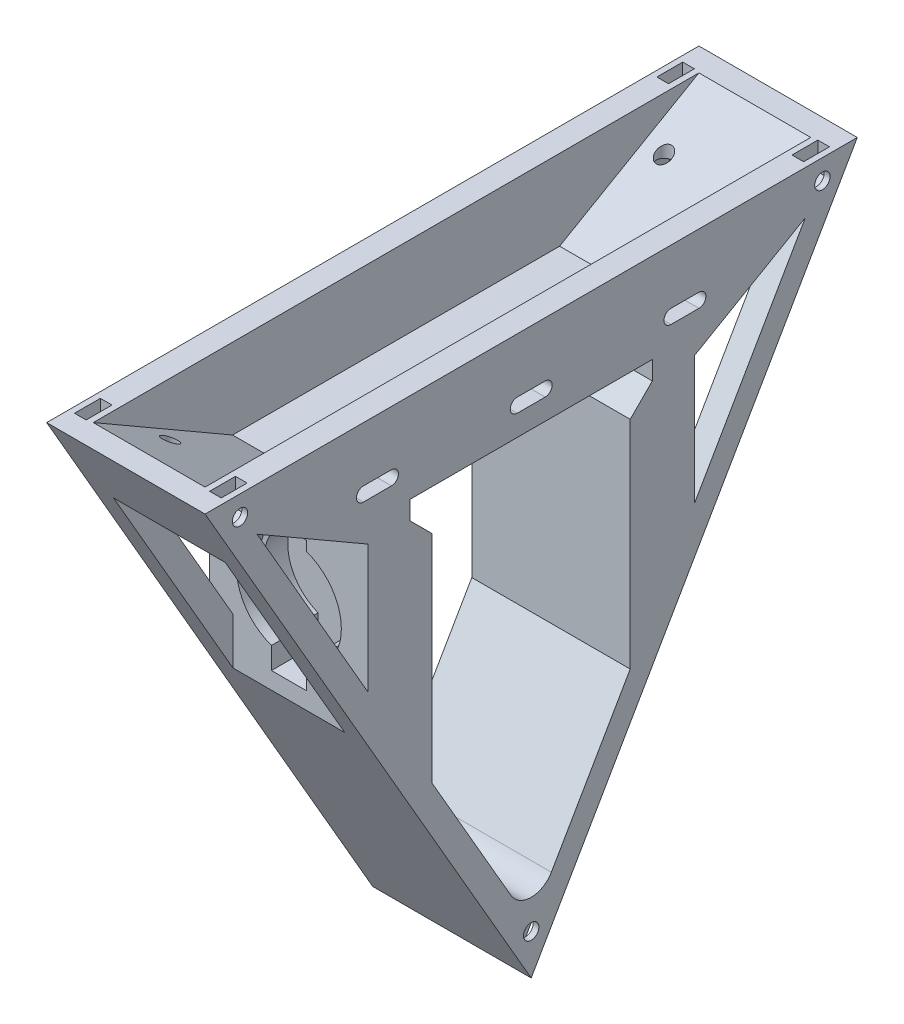
from build123d import *

# Parameters (mm, degrees)
SKETCH1_W                = 34
SKETCH1_H                = 2
BOSS_EXTRUDE1_DEPTH      = 50
BOSS_EXTRUDE2_DEPTH      = 17
BOSS_EXTRUDE2_DEPTH_BACK = 17
BOSS_EXTRUDE3_DEPTH      = 34
CUT_EXTRUDE2_DEPTH       = 34
SKETCH6_W                = 24
SKETCH6_H                = 100
CUT_EXTRUDE3_DEPTH       = 5
CUT_EXTRUDE4_REACH       = 143.028
SKETCH7_W                = 24
SKETCH7_H                = 18
BOSS_EXTRUDE4_DEPTH      = 34
SKETCH9_W                = 24
SKETCH9_H                = 57.679491924
CUT_EXTRUDE5_DEPTH       = 5
SKETCH11_R               = 13.25
SKETCH11_R_2             = 11.25
BOSS_EXTRUDE5_DEPTH      = 10
SKETCH12_R               = 11.25
SKETCH12_R_2             = 10.25
BOSS_EXTRUDE6_DEPTH      = 5
CUT_EXTRUDE7_START       = -10
CUT_EXTRUDE7_DEPTH       = 10
CIRPATTERN1_COUNT        = 2
SKETCH14_W               = 34
SKETCH14_H               = 40.677767497
BOSS_EXTRUDE7_DEPTH      = 10
MIRROR5_START            = -35
MIRROR5_DEPTH            = 10
MIRROR5_START_2          = -30
MIRROR5_2_DEPTH          = 5
BOSS_EXTRUDE14_DEPTH     = 5
CUT_EXTRUDE8_DEPTH       = 5.5
SKETCH24_R               = 1.625
CUT_EXTRUDE9_DEPTH       = 142.028365941
CUT_EXTRUDE10_DEPTH      = 10.5
FILLET3_R                = 5
SKETCH26_R               = 1.65
CUT_EXTRUDE11_DEPTH      = 4
CHAMFER1_SIZE            = 4.75
CUT_EXTRUDE17_DEPTH      = 130.076265064
CUT_EXTRUDE17_DEPTH_BACK = 130.076265064
SKETCH40_W               = 7.5
SKETCH40_H               = 2.568336691
CUT_EXTRUDE18_DEPTH      = 10
BOSS_EXTRUDE21_DEPTH     = 34
CUT_EXTRUDE19_DEPTH      = 118.053621039
SKETCH45_R               = 1.65
CUT_EXTRUDE20_DEPTH      = 0.6
CUT_EXTRUDE21_START      = -1.25
CUT_EXTRUDE21_DEPTH      = 2.5
CIRPATTERN3_COUNT        = 2
CIRPATTERN3_ANGLE        = 120
MIRROR14_START           = -1.25
MIRROR14_COPY_1_DEPTH    = 2.5
MIRROR14_COPY_2_DEPTH    = 2.5


# Read off the part's stored shape, not the designer's step: Mirror5
with BuildPart() as part:
    # Sketch1 → Boss-Extrude1 (new, symmetric)
    with BuildSketch(Plane.XY):
        Rectangle(SKETCH1_W, SKETCH1_H)
    extrude(amount=BOSS_EXTRUDE1_DEPTH, both=True)



with BuildPart() as body_2:
    # Sketch3 → Boss-Extrude2 (new, two sides: drawn at the far end of the back side and taken through both)
    with BuildSketch(Plane(origin=(0, 0, 0), x_dir=(0, 0, -1), z_dir=(1, 0, 0)).offset(-BOSS_EXTRUDE2_DEPTH_BACK)):
        Polygon((-70, 18.264518843), (0, -102.979037687), (70, 18.264518843), align=None)
        Polygon((61.339745962, 13.264518843), (-61.339745962, 13.264518843), (0, -92.979037687), align=None, mode=Mode.SUBTRACT)
    extrude(amount=BOSS_EXTRUDE2_DEPTH + BOSS_EXTRUDE2_DEPTH_BACK)


with BuildPart() as part_1:
    add(part.part)

    add(body_2.part)  # Boss-Extrude3 merges body 2
    # Sketch4 → Boss-Extrude3 (add)
    with BuildSketch(Plane(origin=(17, 0, 0), x_dir=(0, 0, -1), z_dir=(1, 0, 0))):
        Polygon((-58.839745962, 8.934391824), (-45.096976195, 1), (-35.096976195, 1), (-56.339745962, 13.264518843), (-61.339745962, 13.264518843), align=None)
    boss_extrude3 = extrude(amount=-BOSS_EXTRUDE3_DEPTH)

    # Sketch5 → Cut-Extrude2 (cut)
    with BuildSketch(Plane(origin=(17, 0, 0), x_dir=(0, 0, -1), z_dir=(1, 0, 0))):
        Polygon((-45.096976195, 1), (-41.63287458, -1), (-50, -1), (-50, 1), align=None)
    cut_extrude2 = extrude(amount=-CUT_EXTRUDE2_DEPTH, mode=Mode.SUBTRACT)

    # Sketch6 → Cut-Extrude3 (cut)
    with BuildSketch(Plane(origin=(0, 18.264518843, 0), x_dir=(1, 0, 0), z_dir=(0, 1, 0))):
        Rectangle(SKETCH6_W, SKETCH6_H)
    cut_extrude3 = extrude(amount=-CUT_EXTRUDE3_DEPTH, mode=Mode.SUBTRACT)

    # Cut-Extrude4: up to this face of the body (flat: up to its plane)
    cut_extrude4_end = Plane(part_1.part.faces().sort_by_distance((0, 7.132259422, 45.718361079))[0])
    # Sketch7 → Cut-Extrude4 (cut, up to the picked face)
    with BuildSketch(Plane(origin=(0, 18.264518843, 0), x_dir=(1, 0, 0), z_dir=(0, 1, 0)), mode=Mode.PRIVATE) as cut_extrude4_sk1:
        with Locations((0, -59)):
            Rectangle(SKETCH7_W, SKETCH7_H)
    cut_extrude4_tool1 = split(extrude(cut_extrude4_sk1.sketch, amount=-CUT_EXTRUDE4_REACH, mode=Mode.PRIVATE), bisect_by=cut_extrude4_end, keep=Keep.BOTH, mode=Mode.PRIVATE)
    cut_extrude4 = cut_extrude4_tool1.solids().sort_by(Axis((0, 18.264519, 59), (0, -1, 0)))[0]
    add(cut_extrude4, mode=Mode.SUBTRACT)

    # Mirror1: Boss-Extrude3, Cut-Extrude2, Cut-Extrude3, Cut-Extrude4 across plane
    add(boss_extrude3.mirror(Plane.XY))
    add(cut_extrude2.mirror(Plane.XY), mode=Mode.SUBTRACT)
    add(cut_extrude3.mirror(Plane.XY), mode=Mode.SUBTRACT)
    add(cut_extrude4.mirror(Plane.XY), mode=Mode.SUBTRACT)

    # Sketch8 → Boss-Extrude4 (add)
    with BuildSketch(Plane(origin=(17, 0, 0), x_dir=(0, 0, -1), z_dir=(1, 0, 0))):
        Polygon((-30, -1), (-30, -9), (-25, -9), (-25, -49.677767497), (-21.25, -56.172958026), (-21.25, -5), (-26, -5), (-26, -1), align=None)
    boss_extrude4 = extrude(amount=-BOSS_EXTRUDE4_DEPTH)

    # Sketch9 → Cut-Extrude5 (cut)
    with BuildSketch(Plane(origin=(0, -25.744759422, 44.591231347), x_dir=(1, 0, 0), z_dir=(0, -0.5000000000000003, 0.8660254037844385))):
        with Locations((0, 3.317537306)):
            Rectangle(SKETCH9_W, SKETCH9_H)
    cut_extrude5 = extrude(amount=-CUT_EXTRUDE5_DEPTH, mode=Mode.SUBTRACT)

    # Mirror2: Boss-Extrude4, Cut-Extrude5 across plane
    add(boss_extrude4.mirror(Plane.XY))
    add(cut_extrude5.mirror(Plane.XY), mode=Mode.SUBTRACT)

    # Sketch11 → Boss-Extrude5 (add)
    with BuildSketch(Plane.XY.offset(25)):
        with Locations((0, -23.423820239)):
            Circle(SKETCH11_R)
        with Locations(Location((0, -23.423820239, 0), (0, 0, 270))):
            Circle(SKETCH11_R_2, mode=Mode.SUBTRACT)
    extrude(amount=BOSS_EXTRUDE5_DEPTH)

    # Sketch12 → Boss-Extrude6 (add)
    with BuildSketch(Plane.XY.offset(25)):
        with Locations((0, -23.423820239)):
            Circle(SKETCH12_R)
        with Locations(Location((0, -23.423820239, 0), (0, 0, 270))):
            Circle(SKETCH12_R_2, mode=Mode.SUBTRACT)
    extrude(amount=BOSS_EXTRUDE6_DEPTH)

    # Sketch13 → Cut-Extrude7 (cut)
    with BuildSketch(Plane.XY.offset(35).offset(CUT_EXTRUDE7_START)):
        with BuildLine():
            Line((-3.75, -13.884428225), (-3.75, -10.715555212))
            ThreePointArc((-3.75, -10.715555212), (0, -10.173820239), (3.75, -10.715555212))
            Line((3.75, -10.715555212), (3.75, -13.884428225))
            ThreePointArc((3.75, -13.884428225), (0, -13.173820239), (-3.75, -13.884428225))
        make_face()
    cut_extrude7 = extrude(amount=CUT_EXTRUDE7_DEPTH, mode=Mode.SUBTRACT)

    # CirPattern1: Cut-Extrude7 ×2 about axis
    cirpattern1_axis = Axis((0, -23.423820239, 35), (0, 0, -1))
    for i in range(1, CIRPATTERN1_COUNT):
        add(cut_extrude7.rotate(cirpattern1_axis, i * 360 / CIRPATTERN1_COUNT), mode=Mode.SUBTRACT)

    # Sketch14 → Boss-Extrude7 (add)
    with BuildSketch(Plane.XY.offset(25)):
        with Locations((0, -29.338883749)):
            Rectangle(SKETCH14_W, SKETCH14_H)
        with BuildLine():
            ThreePointArc((3.75, -10.715555212), (13.25, -23.423820239), (3.75, -36.132085266))
            Line((3.75, -36.132085266), (-3.75, -36.132085266))
            ThreePointArc((-3.75, -36.132085266), (-13.25, -23.423820239), (-3.75, -10.715555212))
            Line((-3.75, -10.715555212), (3.75, -10.715555212))
        make_face(mode=Mode.SUBTRACT)
    extrude(amount=BOSS_EXTRUDE7_DEPTH)

    # Mirror5 outline → Mirror5 (add)
    with BuildSketch(Plane.XY.offset(MIRROR5_START)):
        Polygon((-17, -9), (-17, -49.677767497), (17, -49.677767497), (17, -9), (12, -9), (-12, -9), align=None)
        with BuildLine():
            Line((3.75, -36.132085266), (-3.75, -36.132085266))
            Line((-3.75, -36.132085266), (-3.75, -34.030421957))
            ThreePointArc((-3.75, -34.030421957), (-11.25, -23.423820239), (-3.75, -12.817218521))
            Line((-3.75, -12.817218521), (-3.75, -10.715555212))
            Line((-3.75, -10.715555212), (3.75, -10.715555212))
            Line((3.75, -10.715555212), (3.75, -12.817218521))
            ThreePointArc((3.75, -12.817218521), (11.25, -23.423820239), (3.75, -34.030421957))
            Line((3.75, -34.030421957), (3.75, -36.132085266))
        make_face(mode=Mode.SUBTRACT)
    extrude(amount=MIRROR5_DEPTH)

    # Mirror5 2 outline → Mirror5 2 (add)
    with BuildSketch(Plane.XY.offset(MIRROR5_START_2)):
        with BuildLine():
            ThreePointArc((-3.75, -12.817218521), (-11.25, -23.423820239), (-3.75, -34.030421957))
            Line((-3.75, -34.030421957), (-3.75, -32.963212253))
            ThreePointArc((-3.75, -32.963212253), (-10.25, -23.423820239), (-3.75, -13.884428225))
            Line((-3.75, -13.884428225), (-3.75, -12.817218521))
        make_face()
        with BuildLine():
            Line((3.75, -32.963212253), (3.75, -34.030421957))
            ThreePointArc((3.75, -34.030421957), (11.25, -23.423820239), (3.75, -12.817218521))
            Line((3.75, -12.817218521), (3.75, -13.884428225))
            ThreePointArc((3.75, -13.884428225), (10.25, -23.423820239), (3.75, -32.963212253))
        make_face()
    extrude(amount=MIRROR5_2_DEPTH)

    # Sketch22 → Boss-Extrude14 (add)
    with BuildSketch(Plane(origin=(17, 0, 0), x_dir=(0, 0, -1), z_dir=(1, 0, 0))):
        Polygon((-35.096976195, 1), (-56.339745962, 13.264518843), (56.339745962, 13.264518843), (35.096976195, 1), align=None)
    boss_extrude14 = extrude(amount=-BOSS_EXTRUDE14_DEPTH)

    # Mirror6: Boss-Extrude14 across plane
    add(boss_extrude14.mirror(Plane(origin=(0, 0, 0), x_dir=(0, 0, 1), z_dir=(1, 0, 0))))

    # Sketch23 → Cut-Extrude8 (cut)
    with BuildSketch(Plane.ZY.offset(-17)):
        with BuildLine():
            Line((-36, 6.5), (-30, 6.5))
            ThreePointArc((-30, 6.5), (-28.5, 5), (-30, 3.5))
            Line((-30, 3.5), (-36, 3.5))
            ThreePointArc((-36, 3.5), (-37.5, 5), (-36, 6.5))
        make_face()
        with BuildLine():
            Line((30, 6.5), (36, 6.5))
            ThreePointArc((36, 6.5), (37.5, 5), (36, 3.5))
            Line((36, 3.5), (30, 3.5))
            ThreePointArc((30, 3.5), (28.5, 5), (30, 6.5))
        make_face()
        with BuildLine():
            Line((-3, 6.5), (3, 6.5))
            ThreePointArc((3, 6.5), (4.5, 5), (3, 3.5))
            Line((3, 3.5), (-3, 3.5))
            ThreePointArc((-3, 3.5), (-4.5, 5), (-3, 6.5))
        make_face()
    extrude(amount=CUT_EXTRUDE8_DEPTH, mode=Mode.SUBTRACT)

    # Sketch24 → Cut-Extrude9 (cut, symmetric)
    with BuildSketch(Plane(origin=(0, 18.264518843, 0), x_dir=(1, 0, 0), z_dir=(0, 1, 0))):
        with Locations(Location((-7.5, -53, 0), (0, 0, 270))):
            Circle(SKETCH24_R)
        with Locations(Location((7.5, -53, 0), (0, 0, 270))):
            Circle(SKETCH24_R)
    cut_extrude9 = extrude(amount=CUT_EXTRUDE9_DEPTH, both=True, mode=Mode.SUBTRACT)

    # Sketch25 → Cut-Extrude10 (cut)
    with BuildSketch(Plane.XZ.offset(1)):
        Polygon((-10.68, 53), (-9.09, 50.246039216), (-5.91, 50.246039216), (-4.32, 53), (-5.91, 55.753960784), (-9.09, 55.753960784), align=None)
        Polygon((4.32, 53), (5.91, 50.246039216), (9.09, 50.246039216), (10.68, 53), (9.09, 55.753960784), (5.91, 55.753960784), align=None)
    cut_extrude10 = extrude(amount=-CUT_EXTRUDE10_DEPTH, mode=Mode.SUBTRACT)

    # Mirror7: Cut-Extrude9, Cut-Extrude10 across plane
    add(cut_extrude9.mirror(Plane.XY), mode=Mode.SUBTRACT)
    add(cut_extrude10.mirror(Plane.XY), mode=Mode.SUBTRACT)

    # Fillet3
    fillet3_edges = [part_1.edges().sort_by_distance(p)[0] for p in [
        (0, -92.979037687, 0),
    ]]
    fillet(fillet3_edges, radius=FILLET3_R)

    # Sketch26 → Cut-Extrude11 (cut)
    with BuildSketch(Plane.ZY.offset(17)):
        with Locations((-62.5, 13.934391824)):
            Circle(SKETCH26_R)
        with Locations((62.5, 13.934391824)):
            Circle(SKETCH26_R)
        with Locations((0, -94.318783649)):
            Circle(SKETCH26_R)
    cut_extrude11 = extrude(amount=-CUT_EXTRUDE11_DEPTH, mode=Mode.SUBTRACT)

    # Chamfer1
    chamfer1_edges = [part_1.edges().sort_by_distance(p)[0] for p in [
        (0, -5, -21.25),
        (0, -5, 21.25),
    ]]
    chamfer(chamfer1_edges, length=CHAMFER1_SIZE - 0.0001)  # a hair under: the kernel refuses the full size

    # Sketch39 → Cut-Extrude17 (cut, two sides: drawn at the far end of the back side and taken through both)
    with BuildSketch(Plane.ZY.offset(17).offset(-CUT_EXTRUDE17_DEPTH_BACK)):
        Polygon((-30.773502692, -49.677767497), (-35, -42.357259422), (-35, -49.677767497), align=None)
        Polygon((30.773502692, -49.677767497), (35, -49.677767497), (35, -42.357259422), align=None)
    extrude(amount=CUT_EXTRUDE17_DEPTH + CUT_EXTRUDE17_DEPTH_BACK, mode=Mode.SUBTRACT)

    # Sketch40 → Cut-Extrude18 (cut)
    with BuildSketch(Plane.XY.offset(35)):
        with Locations((0, -37.416253612)):
            Rectangle(SKETCH40_W, SKETCH40_H)
    cut_extrude18 = extrude(amount=-CUT_EXTRUDE18_DEPTH, mode=Mode.SUBTRACT)

    # Sketch41 → Boss-Extrude21 (add, through all)
    with BuildSketch(Plane(origin=(17, 0, 0), x_dir=(0, 0, -1), z_dir=(1, 0, 0))):
        Polygon((-41.63287458, -1), (-35, -4.829491924), (-35, -9), (-30, -9), (-30, -1), align=None)
        Polygon((30, -1), (41.63287458, -1), (35, -4.829491924), (35, -9), (30, -9), align=None)
    extrude(amount=-BOSS_EXTRUDE21_DEPTH)

    # Sketch42 → Cut-Extrude19 (cut, through all)
    with BuildSketch(Plane.XZ.offset(10.715555212)):
        with BuildLine():
            Line((-2, 28.5), (2, 28.5))
            ThreePointArc((2, 28.5), (3, 27.5), (2, 26.5))
            Line((2, 26.5), (-2, 26.5))
            ThreePointArc((-2, 26.5), (-3, 27.5), (-2, 28.5))
        make_face()
    cut_extrude19 = extrude(amount=-CUT_EXTRUDE19_DEPTH, mode=Mode.SUBTRACT)

    # Mirror11: Cut-Extrude18, Cut-Extrude19 across plane
    add(cut_extrude18.mirror(Plane.XY), mode=Mode.SUBTRACT)
    add(cut_extrude19.mirror(Plane.XY), mode=Mode.SUBTRACT)

    # Sketch45 → Cut-Extrude20 (cut)
    with BuildSketch(Plane.ZY.offset(13)):
        with Locations((-62.5, 13.934391824)):
            Circle(SKETCH45_R)
        with Locations((62.5, 13.934391824)):
            Circle(SKETCH45_R)
        with Locations((0, -94.318783649)):
            Circle(SKETCH45_R)
    cut_extrude20 = extrude(amount=-CUT_EXTRUDE20_DEPTH, mode=Mode.SUBTRACT)

    # Sketch46 → Cut-Extrude21 (cut)
    with BuildSketch(Plane.ZY.offset(17).offset(CUT_EXTRUDE21_START)):
        Polygon((-65.275, 13.934391824), (-65.275, 18.264518843), (-59.725, 18.264518843), (-59.725, 13.934391824), (-59.725, 12.332244827), (-62.5, 10.73009783), (-65.275, 12.332244827), align=None)
    cut_extrude21 = extrude(amount=-CUT_EXTRUDE21_DEPTH, mode=Mode.SUBTRACT)

    # CirPattern3: Cut-Extrude21 ×2 about axis
    cirpattern3_axis = Axis((0, -22.15, 0), (-1, 0, 0))
    for i in range(1, CIRPATTERN3_COUNT):
        add(cut_extrude21.rotate(cirpattern3_axis, i * CIRPATTERN3_ANGLE / (CIRPATTERN3_COUNT - 1)), mode=Mode.SUBTRACT)

    # Mirror13: Cut-Extrude21 across plane
    add(cut_extrude21.mirror(Plane.XY), mode=Mode.SUBTRACT)

    # Mirror14: Cut-Extrude11, Cut-Extrude20, Cut-Extrude21 across plane
    add(cut_extrude11.mirror(Plane(origin=(0, 0, 0), x_dir=(0, 0, 1), z_dir=(1, 0, 0))), mode=Mode.SUBTRACT)
    add(cut_extrude20.mirror(Plane(origin=(0, 0, 0), x_dir=(0, 0, 1), z_dir=(1, 0, 0))), mode=Mode.SUBTRACT)
    add(cut_extrude21.mirror(Plane(origin=(0, 0, 0), x_dir=(0, 0, 1), z_dir=(1, 0, 0))), mode=Mode.SUBTRACT)

    # Mirror14 copy 1 sketch → Mirror14 copy 1 (cut)
    with BuildSketch(Plane(origin=(17, -33.225, -19.182462694), x_dir=(0, 0.866025403784436, -0.5000000000000044), z_dir=(1, 0, 0)).offset(MIRROR14_START)):
        Polygon((-65.275, -13.934391824), (-65.275, -18.264518843), (-59.725, -18.264518843), (-59.725, -13.934391824), (-59.725, -12.332244827), (-62.5, -10.73009783), (-65.275, -12.332244827), align=None)
    extrude(amount=-MIRROR14_COPY_1_DEPTH, mode=Mode.SUBTRACT)

    # Mirror14 copy 2 sketch → Mirror14 copy 2 (cut)
    with BuildSketch(Plane(origin=(17, 0, 0), x_dir=(0, 0, -1), z_dir=(1, 0, 0)).offset(MIRROR14_START)):
        Polygon((-65.275, 13.934391824), (-65.275, 18.264518843), (-59.725, 18.264518843), (-59.725, 13.934391824), (-59.725, 12.332244827), (-62.5, 10.73009783), (-65.275, 12.332244827), align=None)
    extrude(amount=-MIRROR14_COPY_2_DEPTH, mode=Mode.SUBTRACT)


solid = part_1.part
